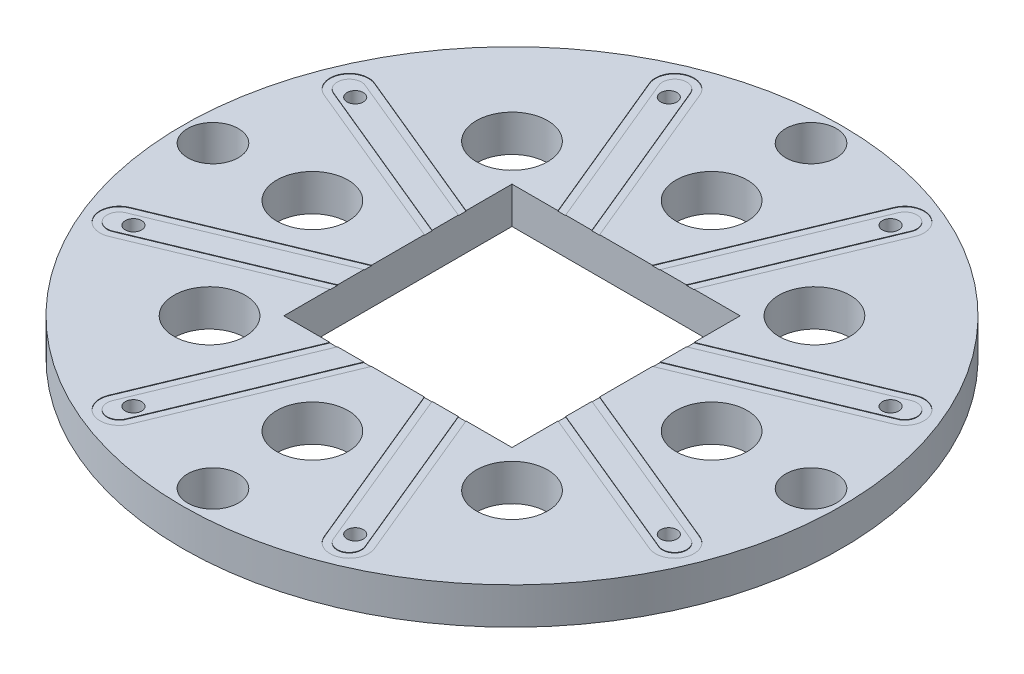
from build123d import *

# Parameters (mm, degrees)
BODAY_SKETCH_R        = 11.557
BODY_DEPTH            = 1.27
COPPER_START          = 0.017500092
COPPER_SKETCH_R       = 11.557
COPPER_DEPTH          = 0.017500092
F_0_CLEARANCE_HOLE1_D = 1.778
SCREW_HOLES_COUNT     = 4
GAP_CUT_DEPTH         = 17.39333395
CENTER_DEPTH          = 0.017500092
IO_HOLE_SKETCH_R      = 0.287000061
IO_HOLE_DEPTH         = 17.39333395
GAP_CUTS_COUNT        = 8
CENTERS_COUNT         = 8
IO_HOLES_COUNT        = 8
POCKET_DEPTH          = 17.39333395
POCKET_DEPTH_BACK     = 17.39333395
POCKET_SKETCH_W       = 8.000000002
POCKET_SKETCH_H       = 8.000000002
POSTS_R               = 1.25000004
POST_CUT_DEPTH        = 17.39333395
POST_CUTS_COUNT       = 4


with BuildPart() as part:
    # Boday Sketch → Body (new body)
    with BuildSketch(Plane(origin=(0, 0, 0), x_dir=(1, 0, 0), z_dir=(0, 1, 0))):
        Circle(BODAY_SKETCH_R)
    extrude(amount=-BODY_DEPTH)

    # Copper Sketch → Copper (add)
    with BuildSketch(Plane(origin=(0, 0, 0), x_dir=(1, 0, 0), z_dir=(0, 1, 0)).offset(COPPER_START)):
        Circle(COPPER_SKETCH_R)
    extrude(amount=-COPPER_DEPTH)

    # #0 Clearance Hole1 (through all)
    with Locations(Plane(origin=(0, 0.017500092, 0), x_dir=(-1, 0, 0), z_dir=(0, 1, 0))):
        with Locations((0, -10.486549711)):
            f_0_clearance_hole1 = Hole(F_0_CLEARANCE_HOLE1_D / 2)

    # Screw Holes: #0 Clearance Hole1 ×4 about axis
    screw_holes_axis = Axis((0, 0.0762, 0), (0, -1, 0))
    for i in range(1, SCREW_HOLES_COUNT):
        add(f_0_clearance_hole1.rotate(screw_holes_axis, i * 360 / SCREW_HOLES_COUNT), mode=Mode.SUBTRACT)

    # Gap → Gap Cut (cut, through all)
    with BuildSketch(Plane(origin=(0, 0, 0), x_dir=(1, 0, 0), z_dir=(0, 1, 0))):
        with BuildLine():
            Line((0.623618728, 0.258311335), (-3.410247333, 9.996925487))
            ThreePointArc((-3.410247333, 9.996925487), (-4.292177395, 10.36223288), (-4.657484788, 9.480302817))
            Line((-4.657484788, 9.480302817), (-0.623618728, -0.258311335))
            Line((-0.623618728, -0.258311335), (0.623618728, 0.258311335))
        make_face()
    gap_cut = extrude(amount=GAP_CUT_DEPTH, mode=Mode.SUBTRACT)


with BuildPart() as body_2:
    # Center Sketch → Center (new body)
    with BuildSketch(Plane(origin=(0, 0, 0), x_dir=(1, 0, 0), z_dir=(0, 1, 0))):
        with BuildLine():
            Line((0.392648837, 0.162640474), (-3.641217223, 9.901254626))
            ThreePointArc((-3.641217223, 9.901254626), (-4.196506534, 10.13126299), (-4.426514898, 9.575973679))
            Line((-4.426514898, 9.575973679), (-0.392648837, -0.162640474))
            Line((-0.392648837, -0.162640474), (0.392648837, 0.162640474))
        make_face()
    center = extrude(amount=CENTER_DEPTH)


with BuildPart() as io_hole_tool:
    # IO Hole Sketch → IO Hole (new, symmetric)
    with BuildSketch(Plane(origin=(0, 0, 0), x_dir=(1, 0, 0), z_dir=(0, 1, 0))):
        with Locations((-3.888063673, 9.38661605)):
            Circle(IO_HOLE_SKETCH_R)
    io_hole = extrude(amount=IO_HOLE_DEPTH, both=True)


with BuildPart() as part_1:
    add(part.part)

    # IO Hole: cut by io_hole_tool
    add(io_hole_tool.part, mode=Mode.SUBTRACT)

    # Gap Cuts: Gap Cut ×8 about axis
    gap_cuts_axis = Axis((0, 0.0762, 0), (0, -1, 0))
    for i in range(1, GAP_CUTS_COUNT):
        add(gap_cut.rotate(gap_cuts_axis, i * 360 / GAP_CUTS_COUNT), mode=Mode.SUBTRACT)



with BuildPart() as body_2_1:
    add(body_2.part)

    # IO Hole: cut by io_hole_tool
    add(io_hole_tool.part, mode=Mode.SUBTRACT)


with BuildPart() as part_2:
    add(part_1.part)

    add(body_2_1.part)  # Centers merges body 2
    # Centers: Center ×8 about axis
    centers_axis = Axis((0, 0.0762, 0), (0, -1, 0))
    for i in range(1, CENTERS_COUNT):
        add(center.rotate(centers_axis, i * 360 / CENTERS_COUNT))

    # IO Holes: IO Hole ×8 about axis
    io_holes_axis = Axis((0, 0.0762, 0), (0, -1, 0))
    for i in range(1, IO_HOLES_COUNT):
        add(io_hole.rotate(io_holes_axis, i * 360 / IO_HOLES_COUNT), mode=Mode.SUBTRACT)

    # Pocket Sketch → Pocket (cut, two sides: drawn at the far end of the back side and taken through both)
    with BuildSketch(Plane(origin=(0, 0, 0), x_dir=(1, 0, 0), z_dir=(0, 1, 0)).offset(-POCKET_DEPTH_BACK)):
        Rectangle(POCKET_SKETCH_W, POCKET_SKETCH_H)
    extrude(amount=POCKET_DEPTH + POCKET_DEPTH_BACK, mode=Mode.SUBTRACT)

    # Posts → Post Cut (cut, symmetric)
    with BuildSketch(Plane(origin=(0, 0, 0), x_dir=(1, 0, 0), z_dir=(0, 1, 0))):
        with Locations((0, 6.99999997)):
            Circle(POSTS_R)
        with Locations((-5.303300849, 5.303300849)):
            Circle(POSTS_R)
    post_cut = extrude(amount=POST_CUT_DEPTH, both=True, mode=Mode.SUBTRACT)

    # Post Cuts: Post Cut ×4 about axis
    post_cuts_axis = Axis((0, 0.0762, 0), (0, -1, 0))
    for i in range(1, POST_CUTS_COUNT):
        add(post_cut.rotate(post_cuts_axis, i * 360 / POST_CUTS_COUNT), mode=Mode.SUBTRACT)


solid = part_2.part
